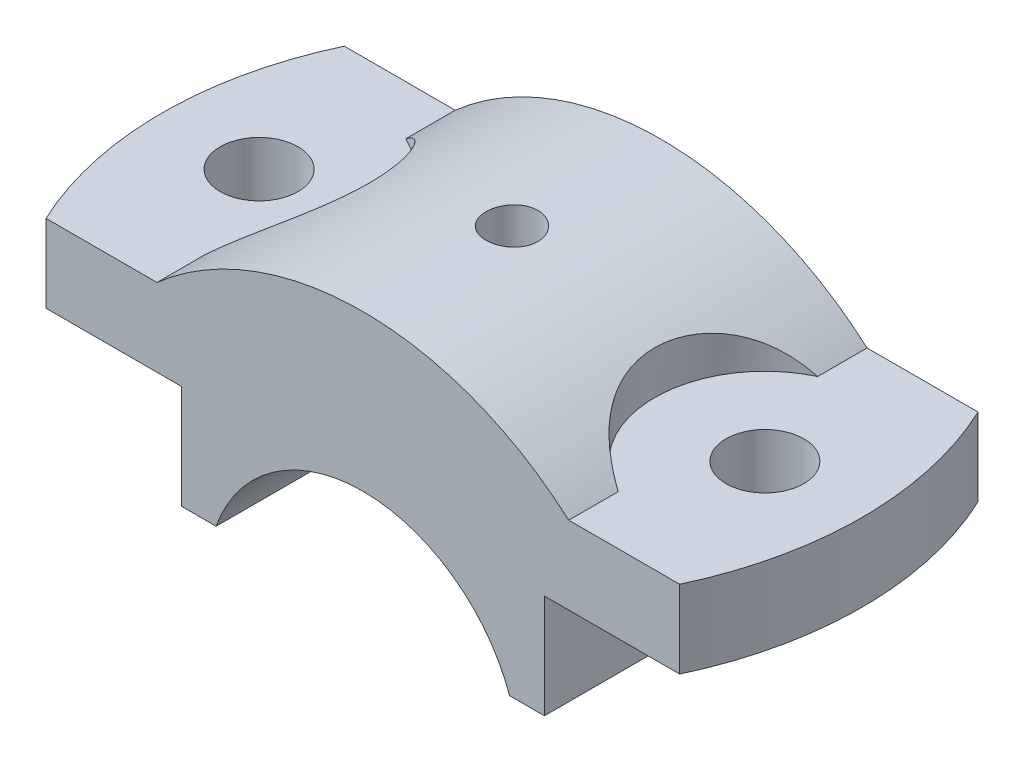
from build123d import *

# Parameters (mm, degrees)
BOSS_EXTRUDE1_DEPTH  = 46
CUT_EXTRUDE1_START   = -4.166957121
CUT_EXTRUDE1_DEPTH   = 17.166957121
CUT_EXTRUDE1_START_2 = 18
CUT_EXTRUDE1_2_DEPTH = 10
SKETCH4_R            = 3
CUT_EXTRUDE2_DEPTH   = 77.26270392
SKETCH5_R            = 17
CUT_EXTRUDE3_DEPTH   = 77.262703957
SKETCH6_R            = 6
CUT_EXTRUDE4_DEPTH   = 77.262703957
CUT_EXTRUDE5_DEPTH   = 86.650452531


with BuildPart() as part:
    # Sketch1 → Boss-Extrude1 (new body)
    with BuildSketch(Plane.XY):
        with BuildLine():
            Line((-28, 8), (-22.627416998, 8))
            ThreePointArc((-22.627416998, 8), (0, 24), (22.627416998, 8))
            Line((22.627416998, 8), (28, 8))
            Line((28, 8), (28, 24))
            Line((28, 24), (54, 24))
            Line((54, 24), (54, 36))
            Line((54, 36), (31.749015733, 36))
            ThreePointArc((31.749015733, 36), (0, 48), (-31.749015733, 36))
            Line((-31.749015733, 36), (-54, 36))
            Line((-54, 36), (-54, 24))
            Line((-54, 24), (-28, 24))
            Line((-28, 24), (-28, 8))
        make_face()
    extrude(amount=BOSS_EXTRUDE1_DEPTH)

    # Cut-Extrude1: read off the stored shape, not the designer's step
    # Cut-Extrude1 outline → Cut-Extrude1 (cut)
    with BuildSketch(Plane(origin=(0, 36, 0), x_dir=(1, 0, 0), z_dir=(0, 1, 0)).offset(CUT_EXTRUDE1_START)):
        with BuildLine():
            add(Edge.make_bspline(
                [(0, -19), (-1.057527997, -19), (-2.091087742, -19.434088276), (-3.566323367, -20.909614388), (-3.999433765, -21.953884044), (-4.00056506, -24.04178128), (-3.576219278, -25.07994956), (-2.083227921, -26.574310552), (-1.045821073, -26.9996204), (1.042915307, -27.000379072), (2.087446575, -26.567981834), (3.563947107, -25.094327717), (3.998968512, -24.060310778), (4.001027689, -21.947486084), (3.568016054, -20.912331491), (2.093312914, -19.435292521), (1.057527997, -19), (0, -19)],
                knots=[0, 0, 0, 0, 0.125, 0.125, 0.25, 0.25, 0.375, 0.375, 0.5, 0.5, 0.625, 0.625, 0.75, 0.75, 0.875, 0.875, 1, 1, 1, 1], degree=3))
        make_face()
    extrude(amount=CUT_EXTRUDE1_DEPTH, mode=Mode.SUBTRACT)

    # Cut-Extrude1 2 outline → Cut-Extrude1 2 (add)
    with BuildSketch(Plane.XY.offset(CUT_EXTRUDE1_START_2)):
        with BuildLine():
            ThreePointArc((4.00000004, 31.83304297), (-2.3e-08, 32), (-4.000000085, 31.833042966))
            Line((-4.000000085, 31.833042966), (4.00000004, 31.83304297))
        make_face()
    extrude(amount=CUT_EXTRUDE1_2_DEPTH)

    # Sketch4 → Cut-Extrude2 (cut, through all)
    with BuildSketch(Plane(origin=(0, 36, 0), x_dir=(1, 0, 0), z_dir=(0, 1, 0))):
        with Locations(Location((0, -23, 0), (0, 0, 270))):
            Circle(SKETCH4_R)
    extrude(amount=-CUT_EXTRUDE2_DEPTH, mode=Mode.SUBTRACT)

    # Sketch5 → Cut-Extrude3 (cut, through all)
    with BuildSketch(Plane(origin=(0, 36, 0), x_dir=(1, 0, 0), z_dir=(0, 1, 0))):
        with Locations((-39, -23)):
            Circle(SKETCH5_R)
        with Locations((39, -23)):
            Circle(SKETCH5_R)
    extrude(amount=CUT_EXTRUDE3_DEPTH, mode=Mode.SUBTRACT)

    # Sketch6 → Cut-Extrude4 (cut, through all)
    with BuildSketch(Plane(origin=(0, 36, 0), x_dir=(1, 0, 0), z_dir=(0, 1, 0))):
        with Locations(Location((-39, -23, 0), (0, 0, 270))):
            Circle(SKETCH6_R)
        with Locations(Location((39, -23, 0), (0, 0, 270))):
            Circle(SKETCH6_R)
    extrude(amount=-CUT_EXTRUDE4_DEPTH, mode=Mode.SUBTRACT)

    # Sketch8 → Cut-Extrude5 (cut, through all)
    with BuildSketch(Plane(origin=(0, 0, 0), x_dir=(1, 0, 0), z_dir=(0, 1, 0))):
        with BuildLine():
            Line((-48.61841215, -46.5), (-63.61841215, -46.5))
            Line((-63.61841215, -46.5), (-63.61841215, 0.5))
            Line((-63.61841215, 0.5), (-48.61841215, 0.5))
            ThreePointArc((-48.61841215, 0.5), (-54, -23), (-48.61841215, -46.5))
        make_face()
    cut_extrude5 = extrude(amount=CUT_EXTRUDE5_DEPTH, mode=Mode.SUBTRACT)

    # Mirror1: Cut-Extrude5 across plane
    add(cut_extrude5.mirror(Plane(origin=(0, 0, 0), x_dir=(0, 0, 1), z_dir=(1, 0, 0))), mode=Mode.SUBTRACT)


solid = part.part
